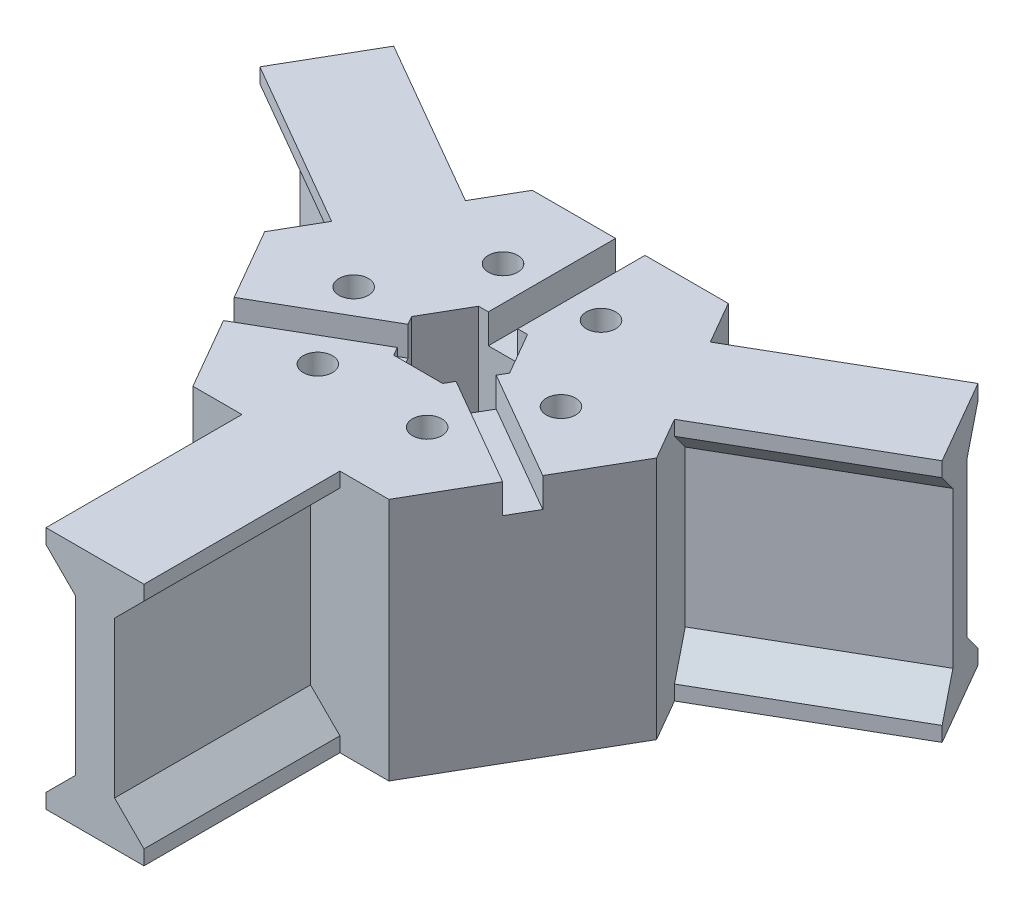
from build123d import *

# Parameters (mm, degrees)
SKETCH1_R           = 3
SKETCH1_W           = 6
SKETCH1_H           = 40
SKETCH1_W_2         = 8
BOSS_EXTRUDE1_DEPTH = 49.8
SKETCH1_4_W         = 6
SKETCH1_4_H         = 40
CUT_EXTRUDE2_DEPTH  = 46.8
SKETCH1_5_W         = 6
SKETCH1_5_H         = 40
BOSS_EXTRUDE3_DEPTH = 3
CHAMFER1_SIZE       = 6
SKETCH2_3_W         = 6
SKETCH2_3_H         = 17.980762113
SKETCH2_3_H_2       = 3
SKETCH2_3_H_3       = 5
CUT_EXTRUDE3_DEPTH  = 6


with BuildPart() as part:
    # Sketch1 → Boss-Extrude1 (new body)
    # profile 1 of 10: a face of its own
    with BuildSketch(Plane(origin=(0, 0, 0), x_dir=(1, 0, 0), z_dir=(0, 1, 0))):
        Polygon((20, -34.641016151), (40, 0), (20, 34.641016151), (-20, 34.641016151), (-40, 0), (-20, -34.641016151), align=None)
        with Locations(Location((21.160254038, -0.669872981, 0), (0, 0, 270))):
            Circle(SKETCH1_R, mode=Mode.SUBTRACT)
        with Locations(Location((10, 18.660254038, 0), (0, 0, 270))):
            Circle(SKETCH1_R, mode=Mode.SUBTRACT)
        with Locations(Location((-10, 18.660254038, 0), (0, 0, 270))):
            Circle(SKETCH1_R, mode=Mode.SUBTRACT)
        with Locations(Location((-21.160254038, -0.669872981, 0), (0, 0, 270))):
            Circle(SKETCH1_R, mode=Mode.SUBTRACT)
        with Locations(Location((11.160254038, -17.990381057, 0), (0, 0, 270))):
            Circle(SKETCH1_R, mode=Mode.SUBTRACT)
        with Locations(Location((-11.160254038, -17.990381057, 0), (0, 0, 270))):
            Circle(SKETCH1_R, mode=Mode.SUBTRACT)
        Polygon((10, 0), (5, 8.660254038), (-5, 8.660254038), (-10, 0), (-5, -8.660254038), (5, -8.660254038), align=None, mode=Mode.SUBTRACT)
    # profile 2 of 10: a face of its own
    with BuildSketch(Plane(origin=(0, 0, 0), x_dir=(1, 0, 0), z_dir=(0, 1, 0))):
        Polygon((-28, 20.784609691), (-25, 25.980762114), (-59.641016151, 45.980762114), (-62.641016151, 40.784609691), align=None)
    # profile 3 of 10: a face of its own
    with BuildSketch(Plane(origin=(0, 0, 0), x_dir=(1, 0, 0), z_dir=(0, 1, 0))):
        Polygon((-32, 13.856406461), (-28, 20.784609691), (-62.641016151, 40.784609691), (-66.641016151, 33.856406461), align=None)
    # profile 4 of 10: a face of its own
    with BuildSketch(Plane(origin=(0, 0, 0), x_dir=(1, 0, 0), z_dir=(0, 1, 0))):
        Polygon((-35, 8.660254038), (-32, 13.856406461), (-66.641016151, 33.856406461), (-69.641016151, 28.660254038), align=None)
    # profile 5 of 10: a face of its own
    with BuildSketch(Plane(origin=(0, 0, 0), x_dir=(1, 0, 0), z_dir=(0, 1, 0))):
        Polygon((59.641016151, 45.980762114), (25, 25.980762114), (28, 20.784609691), (62.641016151, 40.784609691), align=None)
    # profile 6 of 10: a face of its own
    with BuildSketch(Plane(origin=(0, 0, 0), x_dir=(1, 0, 0), z_dir=(0, 1, 0))):
        Polygon((62.641016151, 40.784609691), (28, 20.784609691), (32, 13.856406461), (66.641016151, 33.856406461), align=None)
    # profile 7 of 10: a face of its own
    with BuildSketch(Plane(origin=(0, 0, 0), x_dir=(1, 0, 0), z_dir=(0, 1, 0))):
        Polygon((66.641016151, 33.856406461), (32, 13.856406461), (35, 8.660254038), (69.641016151, 28.660254038), align=None)
    # profile 8 of 10: a face of its own
    with BuildSketch(Plane(origin=(0, 0, 0), x_dir=(1, 0, 0), z_dir=(0, 1, 0))):
        with Locations((7, -54.641016151)):
            Rectangle(SKETCH1_W, SKETCH1_H)
    # profile 9 of 10: a face of its own
    with BuildSketch(Plane(origin=(0, 0, 0), x_dir=(1, 0, 0), z_dir=(0, 1, 0))):
        with Locations((-7, -54.641016151)):
            Rectangle(SKETCH1_W, SKETCH1_H)
    # profile 10 of 10: a face of its own
    with BuildSketch(Plane(origin=(0, 0, 0), x_dir=(1, 0, 0), z_dir=(0, 1, 0))):
        with Locations((0, -54.641016151)):
            Rectangle(SKETCH1_W_2, SKETCH1_H)
    extrude(amount=BOSS_EXTRUDE1_DEPTH)

    # Sketch1<4> → Cut-Extrude2 (cut)
    with BuildSketch(Plane(origin=(0, 0, 0), x_dir=(1, 0, 0), z_dir=(0, 1, 0))):
        Polygon((59.641016151, 45.980762114), (25, 25.980762114), (28, 20.784609691), (62.641016151, 40.784609691), align=None)
        Polygon((-28, 20.784609691), (-25, 25.980762114), (-59.641016151, 45.980762114), (-62.641016151, 40.784609691), align=None)
        Polygon((66.641016151, 33.856406461), (32, 13.856406461), (35, 8.660254038), (69.641016151, 28.660254038), align=None)
        Polygon((-35, 8.660254038), (-32, 13.856406461), (-66.641016151, 33.856406461), (-69.641016151, 28.660254038), align=None)
        with Locations((7, -54.641016151)):
            Rectangle(SKETCH1_4_W, SKETCH1_4_H)
        with Locations((-7, -54.641016151)):
            Rectangle(SKETCH1_4_W, SKETCH1_4_H)
    extrude(amount=CUT_EXTRUDE2_DEPTH, mode=Mode.SUBTRACT)

    # Sketch1<5> → Boss-Extrude3 (add)
    with BuildSketch(Plane(origin=(0, 0, 0), x_dir=(1, 0, 0), z_dir=(0, 1, 0))):
        with Locations((-7, -54.641016151)):
            Rectangle(SKETCH1_5_W, SKETCH1_5_H)
        with Locations((7, -54.641016151)):
            Rectangle(SKETCH1_5_W, SKETCH1_5_H)
        Polygon((-35, 8.660254038), (-32, 13.856406461), (-66.641016151, 33.856406461), (-69.641016151, 28.660254038), align=None)
        Polygon((-28, 20.784609691), (-25, 25.980762114), (-59.641016151, 45.980762114), (-62.641016151, 40.784609691), align=None)
        Polygon((66.641016151, 33.856406461), (32, 13.856406461), (35, 8.660254038), (69.641016151, 28.660254038), align=None)
        Polygon((59.641016151, 45.980762114), (25, 25.980762114), (28, 20.784609691), (62.641016151, 40.784609691), align=None)
    extrude(amount=BOSS_EXTRUDE3_DEPTH)

    # Chamfer1
    chamfer1_edges = [part.edges().sort_by_distance(p)[0] for p in [
        (-45.320508076, 46.8, -30.784609691),
        (-45.320508076, 3, -30.784609691),
        (-49.320508076, 46.8, -23.856406461),
        (-49.320508076, 3, -23.856406461),
        (49.320508076, 46.8, -23.856406461),
        (45.320508076, 46.8, -30.784609691),
        (45.320508076, 3, -30.784609691),
        (49.320508076, 3, -23.856406461),
        (-4, 3, 54.641016151),
        (4, 3, 54.641016151),
        (4, 46.8, 54.641016151),
        (-4, 46.8, 54.641016151),
    ]]
    chamfer(chamfer1_edges, length=CHAMFER1_SIZE - 0.0001)  # a hair under: the kernel refuses the full size

    # Sketch2<3> → Cut-Extrude3 (cut)
    with BuildSketch(Plane(origin=(0, 49.8, 0), x_dir=(1, 0, 0), z_dir=(0, 1, 0))):
        Polygon((-24.169872981, -17.418584287), (-27.169872981, -12.222431864), (-31.5, -14.722431864), (-28.5, -19.918584287), align=None)
        Polygon((-9, -1.732050808), (-11.598076211, -3.232050808), (-8.598076211, -8.42820323), (-6, -6.92820323), align=None)
        Polygon((8.598076211, -8.42820323), (11.598076211, -3.232050808), (9, -1.732050808), (6, -6.92820323), align=None)
        Polygon((31.5, -14.722431864), (27.169872981, -12.222431864), (24.169872981, -17.418584287), (28.5, -19.918584287), align=None)
        Polygon((27.169872981, -12.222431864), (11.598076211, -3.232050808), (8.598076211, -8.42820323), (24.169872981, -17.418584287), align=None)
        Polygon((-11.598076211, -3.232050808), (-27.169872981, -12.222431864), (-24.169872981, -17.418584287), (-8.598076211, -8.42820323), align=None)
        with Locations((0, 20.650635095)):
            Rectangle(SKETCH2_3_W, SKETCH2_3_H)
        with Locations((0, 10.160254038)):
            Rectangle(SKETCH2_3_W, SKETCH2_3_H_2)
        with Locations((0, 32.141016151)):
            Rectangle(SKETCH2_3_W, SKETCH2_3_H_3)
    extrude(amount=-CUT_EXTRUDE3_DEPTH, mode=Mode.SUBTRACT)


solid = part.part
